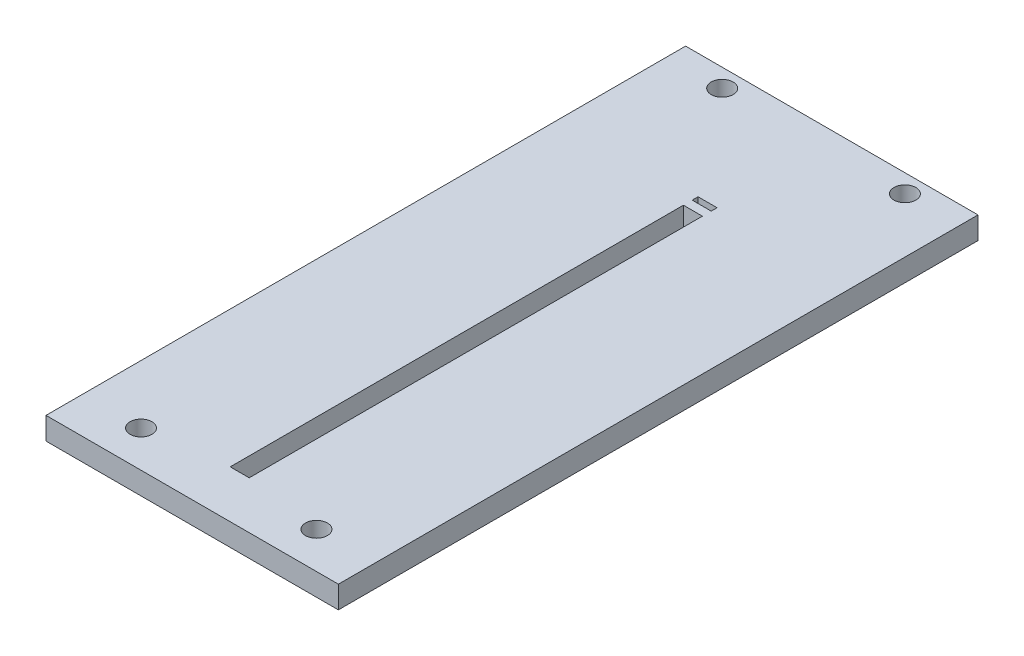
from build123d import *

# Parameters (mm, degrees)
SKETCH1_W             = 40
SKETCH1_H             = 87.5
BOSS_EXTRUDE1_DEPTH   = 3.05
SKETCH4_W             = 2.6
SKETCH4_H             = 0.8
SKETCH4_H_2           = 62
CUT_EXTRUDE1_DEPTH    = 90.808421097
SKETCH7_R             = 1.5
CUT_EXTRUDE4_DEPTH    = 90.808421097
F_3_0MM_DOWEL_HOLE1_D = 3


with BuildPart() as part:
    # Sketch1 → Boss-Extrude1 (new body)
    with BuildSketch(Plane(origin=(0, 0, 0), x_dir=(1, 0, 0), z_dir=(0, 1, 0))):
        with Locations((0, 43.75)):
            Rectangle(SKETCH1_W, SKETCH1_H)
    extrude(amount=BOSS_EXTRUDE1_DEPTH)

    # Sketch4 → Cut-Extrude1 (cut, through all)
    with BuildSketch(Plane(origin=(0, 3.05, 0), x_dir=(1, 0, 0), z_dir=(0, 1, 0))):
        with Locations((0, 70.1)):
            Rectangle(SKETCH4_W, SKETCH4_H)
        with Locations((0, 37.5)):
            Rectangle(SKETCH4_W, SKETCH4_H_2)
    extrude(amount=-CUT_EXTRUDE1_DEPTH, mode=Mode.SUBTRACT)

    # Sketch7 → Cut-Extrude4 (cut, through all)
    with BuildSketch(Plane(origin=(0, 3.05, 0), x_dir=(1, 0, 0), z_dir=(0, 1, 0))):
        with Locations((-12, 5)):
            Circle(SKETCH7_R)
        with Locations((12, 5)):
            Circle(SKETCH7_R)
    extrude(amount=-CUT_EXTRUDE4_DEPTH, mode=Mode.SUBTRACT)

    # Ø3.0mm Dowel Hole1 (through all)
    with Locations(Plane(origin=(0, 3.05, 0), x_dir=(1, 0, 0), z_dir=(0, 1, 0))):
        with Locations((-12.5, 85), (12.5, 85)):
            Hole(F_3_0MM_DOWEL_HOLE1_D / 2)


solid = part.part
